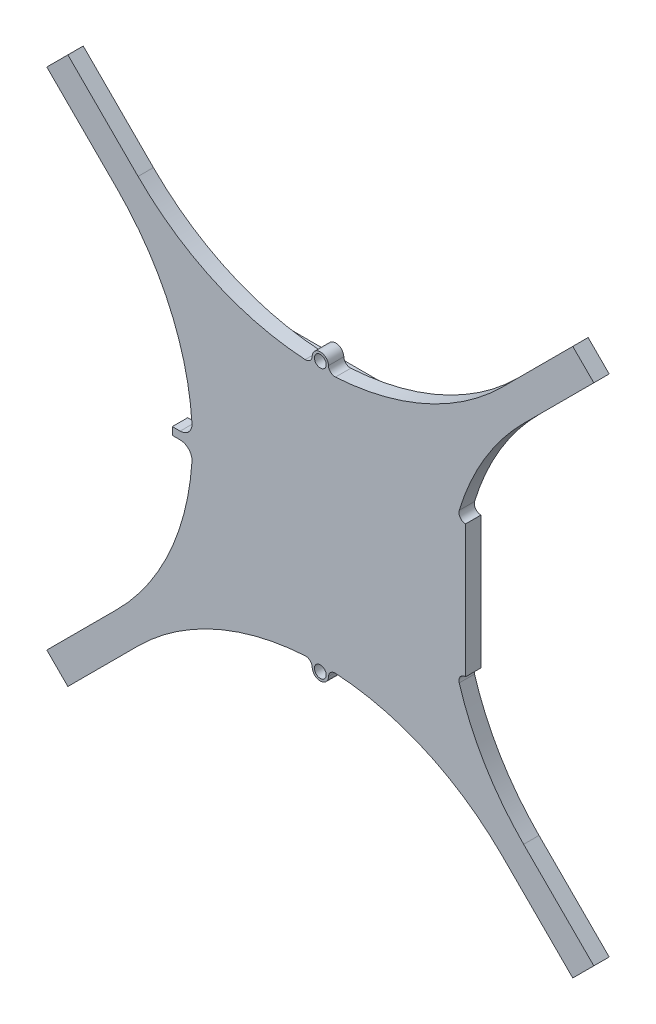
from build123d import *

# Parameters (mm, degrees)
SKETCH1_R           = 0.634780864
BOSS_EXTRUDE1_DEPTH = 1.65
FILLET1_R           = 0.7112
FILLET2_R           = 0.7112
FILLET3_R           = 1.27
SKETCH2_W           = 23
SKETCH2_H           = 2.314
SKETCH2_R           = 0.33
BOSS_EXTRUDE2_DEPTH = 2.6


with BuildPart() as part:
    # Sketch1 → Boss-Extrude1 (new body)
    with BuildSketch(Plane.XY):
        with BuildLine():
            Line((-27.135222714, 29.397964527), (-29.397964527, 27.135222714))
            Line((-29.397964527, 27.135222714), (-21.855060774, 19.592318961))
            ThreePointArc((-21.855060774, 19.592318961), (-15.928204538, 10.7930358), (-13.742710724, 0.41138729))
            Line((-13.742710724, 0.41138729), (-15.908512943, 0.41138729))
            Line((-15.908512943, 0.41138729), (-15.908512943, -0.41138729))
            Line((-15.908512943, -0.41138729), (-13.742710724, -0.41138729))
            ThreePointArc((-13.742710724, -0.41138729), (-15.928204538, -10.7930358), (-21.855060774, -19.592318961))
            Line((-21.855060774, -19.592318961), (-29.397964527, -27.135222714))
            Line((-29.397964527, -27.135222714), (-27.135222714, -29.397964527))
            Line((-27.135222714, -29.397964527), (-19.592318961, -21.855060774))
            ThreePointArc((-19.592318961, -21.855060774), (-10.842511416, -15.949186255), (-0.51885361, -13.744514983))
            ThreePointArc((-0.51885361, -13.744514983), (0, -15.324082887), (0.51885361, -13.744514983))
            ThreePointArc((0.51885361, -13.744514983), (10.842511416, -15.949186255), (19.592318961, -21.855060774))
            Line((19.592318961, -21.855060774), (27.135222714, -29.397964527))
            Line((27.135222714, -29.397964527), (29.397964527, -27.135222714))
            Line((29.397964527, -27.135222714), (21.855060774, -19.592318961))
            ThreePointArc((21.855060774, -19.592318961), (17.437236913, -13.828628501), (14.668755804, -7.114999994))
            Line((14.668755804, -7.114999994), (15.618947426, -7.114999994))
            Line((15.618947426, -7.114999994), (15.618947426, 7.114999994))
            Line((15.618947426, 7.114999994), (14.668755804, 7.114999994))
            ThreePointArc((14.668755804, 7.114999994), (17.437236913, 13.828628501), (21.855060774, 19.592318961))
            Line((21.855060774, 19.592318961), (29.397964527, 27.135222714))
            Line((29.397964527, 27.135222714), (27.135222714, 29.397964527))
            Line((27.135222714, 29.397964527), (19.592318961, 21.855060774))
            ThreePointArc((19.592318961, 21.855060774), (10.842511416, 15.949186255), (0.51885361, 13.744514983))
            ThreePointArc((0.51885361, 13.744514983), (0, 15.324082887), (-0.51885361, 13.744514983))
            ThreePointArc((-0.51885361, 13.744514983), (-10.842511416, 15.949186255), (-19.592318961, 21.855060774))
            Line((-19.592318961, 21.855060774), (-27.135222714, 29.397964527))
        make_face()
        with Locations((0, 14.449082887)):
            Circle(SKETCH1_R, mode=Mode.SUBTRACT)
        with Locations((0, -14.449082887)):
            Circle(SKETCH1_R, mode=Mode.SUBTRACT)
    extrude(amount=BOSS_EXTRUDE1_DEPTH)

    # Fillet1
    fillet1_edges = [part.edges().sort_by_distance(p)[0] for p in [
        (-0.51885361, -13.744514983, 0.825),
        (0.51885361, -13.744514983, 0.825),
        (-0.51885361, 13.744514983, 0.825),
        (0.51885361, 13.744514983, 0.825),
    ]]
    fillet(fillet1_edges, radius=FILLET1_R)

    # Fillet2
    fillet2_edges = [part.edges().sort_by_distance(p)[0] for p in [
        (14.668755804, -7.114999994, 0.825),
        (14.668755804, 7.114999994, 0.825),
    ]]
    fillet(fillet2_edges, radius=FILLET2_R)

    # Fillet3
    fillet3_edges = [part.edges().sort_by_distance(p)[0] for p in [
        (-13.742710724, 0.41138729, 0.825),
        (-13.742710724, -0.41138729, 0.825),
    ]]
    fillet(fillet3_edges, radius=FILLET3_R)

    # Sketch2 → Boss-Extrude2 (add)
    # profile 1 of 2: a face of its own
    with BuildSketch(Plane(origin=(0, 0, 0), x_dir=(-1, 0, 0), z_dir=(0, 0, -1))):
        with Locations((0, 10.385)):
            Rectangle(SKETCH2_W, SKETCH2_H)
        with Locations((-8.002, 10.385)):
            Circle(SKETCH2_R, mode=Mode.SUBTRACT)
        with Locations((-6.224, 10.385)):
            Circle(SKETCH2_R, mode=Mode.SUBTRACT)
        with Locations((-4.446, 10.385)):
            Circle(SKETCH2_R, mode=Mode.SUBTRACT)
        with Locations((-2.668, 10.385)):
            Circle(SKETCH2_R, mode=Mode.SUBTRACT)
        with Locations((-0.89, 10.385)):
            Circle(SKETCH2_R, mode=Mode.SUBTRACT)
        with Locations((0.888, 10.385)):
            Circle(SKETCH2_R, mode=Mode.SUBTRACT)
        with Locations((2.666, 10.385)):
            Circle(SKETCH2_R, mode=Mode.SUBTRACT)
        with Locations((4.444, 10.385)):
            Circle(SKETCH2_R, mode=Mode.SUBTRACT)
        with Locations((6.222, 10.385)):
            Circle(SKETCH2_R, mode=Mode.SUBTRACT)
        with Locations((8, 10.385)):
            Circle(SKETCH2_R, mode=Mode.SUBTRACT)
    # profile 2 of 2: a face of its own
    with BuildSketch(Plane(origin=(0, 0, 0), x_dir=(-1, 0, 0), z_dir=(0, 0, -1))):
        with Locations((0, -10.385)):
            Rectangle(SKETCH2_W, SKETCH2_H)
        with Locations((8, -10.385)):
            Circle(SKETCH2_R, mode=Mode.SUBTRACT)
        with Locations((6.222, -10.385)):
            Circle(SKETCH2_R, mode=Mode.SUBTRACT)
        with Locations((4.444, -10.385)):
            Circle(SKETCH2_R, mode=Mode.SUBTRACT)
        with Locations((2.666, -10.385)):
            Circle(SKETCH2_R, mode=Mode.SUBTRACT)
        with Locations((0.888, -10.385)):
            Circle(SKETCH2_R, mode=Mode.SUBTRACT)
        with Locations((-0.89, -10.385)):
            Circle(SKETCH2_R, mode=Mode.SUBTRACT)
        with Locations((-2.668, -10.385)):
            Circle(SKETCH2_R, mode=Mode.SUBTRACT)
        with Locations((-4.446, -10.385)):
            Circle(SKETCH2_R, mode=Mode.SUBTRACT)
        with Locations((-6.224, -10.385)):
            Circle(SKETCH2_R, mode=Mode.SUBTRACT)
        with Locations((-8.002, -10.385)):
            Circle(SKETCH2_R, mode=Mode.SUBTRACT)
    extrude(amount=BOSS_EXTRUDE2_DEPTH)


solid = part.part
